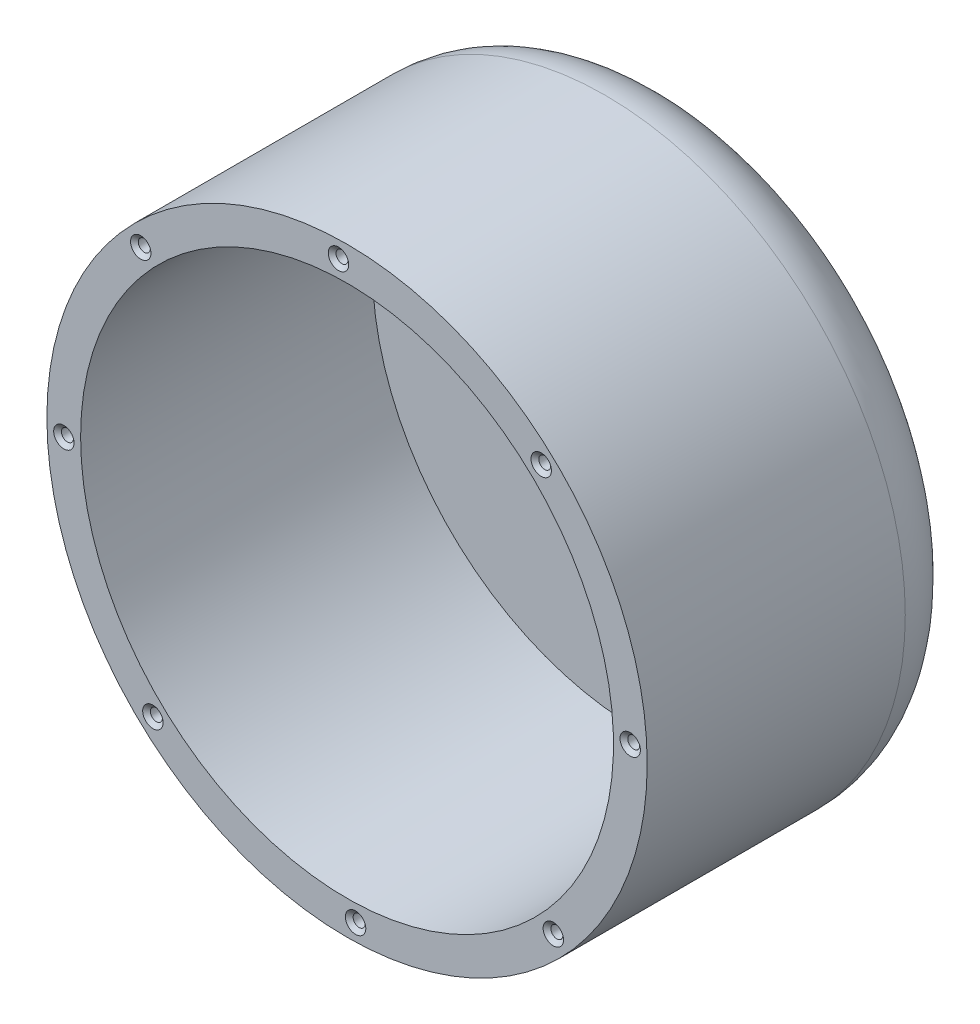
from build123d import *

# Parameters (mm, degrees)
SKETCH1_R                                 = 44.5
BOSS_EXTRUDE1_DEPTH                       = 24.13
SHELL1_T                                  = -5
CSK_FOR_0_FLAT_HEAD_MACHINE_SCREW_2_COUNT = 2
CSK_FOR_0_FLAT_HEAD_MACHINE_SCREW_2_PITCH = 69.412105808
CIRPATTERN1_COUNT                         = 8
FILLET1_R                                 = 10
SCALE1_SCALE                              = 0.5


with BuildPart() as part:
    # Sketch1 → Boss-Extrude1 (new, symmetric)
    with BuildSketch(Plane.XY):
        Circle(SKETCH1_R)
    extrude(amount=BOSS_EXTRUDE1_DEPTH, both=True)

    # Shell1
    shell1_openings = [part.faces().sort_by_distance(p)[0] for p in [
        (0, 0, 24.13),
    ]]
    offset(amount=SHELL1_T, openings=shell1_openings, kind=Kind.INTERSECTION)

    # Sketch5 → CSK for #0 Flat Head Machine Screw (100)1 (revolve, cut)
    with BuildSketch(Plane(origin=(-1.269301035, 41.980815558, 24.13), x_dir=(0, -1, 0), z_dir=(1, 0, 0))):
        Polygon((0, 0), (0, 3.07416509), (0.889, 2.54), (0.889, 0.5221717), (1.5113, 0), align=None)
    csk_for_0_flat_head_machine_screw_100 = revolve(axis=Axis((-1.269301035, 41.980815558, 30.48), (0, 0, -1)), mode=Mode.SUBTRACT)

    # CSK for _0 Flat Head Machine Screw _ 2: CSK for #0 Flat Head Machine Screw (100)1 ×2
    with Locations(*[Vector(0.9567328467758284, -0.2909677987341887, 0) * (i * CSK_FOR_0_FLAT_HEAD_MACHINE_SCREW_2_PITCH) for i in range(1, CSK_FOR_0_FLAT_HEAD_MACHINE_SCREW_2_COUNT)]):
        add(csk_for_0_flat_head_machine_screw_100, mode=Mode.SUBTRACT)

    # CirPattern1: CSK for #0 Flat Head Machine Screw (100)1 ×8 about axis
    cirpattern1_axis = Axis((0, 0, 24.13), (0, 0, -1))
    for i in range(1, CIRPATTERN1_COUNT):
        add(csk_for_0_flat_head_machine_screw_100.rotate(cirpattern1_axis, i * 360 / CIRPATTERN1_COUNT), mode=Mode.SUBTRACT)

    # CirPattern1 copy 1 sketch → CirPattern1 copy 1 (revolve, cut)
    with BuildSketch(Plane(origin=(61.464315428, -30.656906272, 24.13), x_dir=(-0.7071067811865475, -0.7071067811865476, 0), z_dir=(0.7071067811865476, -0.7071067811865475, 0))):
        Polygon((0, 0), (0, 3.07416509), (0.889, 2.54), (0.889, 0.5221717), (1.5113, 0), align=None)
    revolve(axis=Axis((61.464315428, -30.656906272, 30.48), (0, 0, -1)), mode=Mode.SUBTRACT)

    # CirPattern1 copy 2 sketch → CirPattern1 copy 2 (revolve, cut)
    with BuildSketch(Plane(origin=(21.784127925, -65.139540555, 24.13), x_dir=(-1, 0, 0), z_dir=(0, -1, 0))):
        Polygon((0, 0), (0, 3.07416509), (0.889, 2.54), (0.889, 0.5221717), (1.5113, 0), align=None)
    revolve(axis=Axis((21.784127925, -65.139540555, 30.48), (0, 0, -1)), mode=Mode.SUBTRACT)

    # CirPattern1 copy 3 sketch → CirPattern1 copy 3 (revolve, cut)
    with BuildSketch(Plane(origin=(-30.656906272, -61.464315428, 24.13), x_dir=(-0.7071067811865476, 0.7071067811865475, 0), z_dir=(-0.7071067811865475, -0.7071067811865476, 0))):
        Polygon((0, 0), (0, 3.07416509), (0.889, 2.54), (0.889, 0.5221717), (1.5113, 0), align=None)
    revolve(axis=Axis((-30.656906272, -61.464315428, 30.48), (0, 0, -1)), mode=Mode.SUBTRACT)

    # CirPattern1 copy 4 sketch → CirPattern1 copy 4 (revolve, cut)
    with BuildSketch(Plane(origin=(-65.139540555, -21.784127925, 24.13), x_dir=(0, 1, 0), z_dir=(-1, 0, 0))):
        Polygon((0, 0), (0, 3.07416509), (0.889, 2.54), (0.889, 0.5221717), (1.5113, 0), align=None)
    revolve(axis=Axis((-65.139540555, -21.784127925, 30.48), (0, 0, -1)), mode=Mode.SUBTRACT)

    # CirPattern1 copy 5 sketch → CirPattern1 copy 5 (revolve, cut)
    with BuildSketch(Plane(origin=(-61.464315428, 30.656906272, 24.13), x_dir=(0.7071067811865475, 0.7071067811865477, 0), z_dir=(-0.7071067811865477, 0.7071067811865475, 0))):
        Polygon((0, 0), (0, 3.07416509), (0.889, 2.54), (0.889, 0.5221717), (1.5113, 0), align=None)
    revolve(axis=Axis((-61.464315428, 30.656906272, 30.48), (0, 0, -1)), mode=Mode.SUBTRACT)

    # CirPattern1 copy 6 sketch → CirPattern1 copy 6 (revolve, cut)
    with BuildSketch(Plane(origin=(-21.784127925, 65.139540555, 24.13), x_dir=(1, 0, 0), z_dir=(0, 1, 0))):
        Polygon((0, 0), (0, 3.07416509), (0.889, 2.54), (0.889, 0.5221717), (1.5113, 0), align=None)
    revolve(axis=Axis((-21.784127925, 65.139540555, 30.48), (0, 0, -1)), mode=Mode.SUBTRACT)

    # CirPattern1 copy 7 sketch → CirPattern1 copy 7 (revolve, cut)
    with BuildSketch(Plane(origin=(30.656906272, 61.464315428, 24.13), x_dir=(0.7071067811865477, -0.7071067811865474, 0), z_dir=(0.7071067811865474, 0.7071067811865477, 0))):
        Polygon((0, 0), (0, 3.07416509), (0.889, 2.54), (0.889, 0.5221717), (1.5113, 0), align=None)
    revolve(axis=Axis((30.656906272, 61.464315428, 30.48), (0, 0, -1)), mode=Mode.SUBTRACT)

    # Fillet1
    fillet1_edges = [part.edges().sort_by_distance(p)[0] for p in [
        (-44.5, 0, -24.13),
    ]]
    fillet(fillet1_edges, radius=FILLET1_R)


with BuildPart() as part_1:
    # Scale1: scaled about (0, 0, -4.938479744)
    add(part.part.scale(SCALE1_SCALE).moved(Location((0, 0, -2.469239872))))


solid = part_1.part
